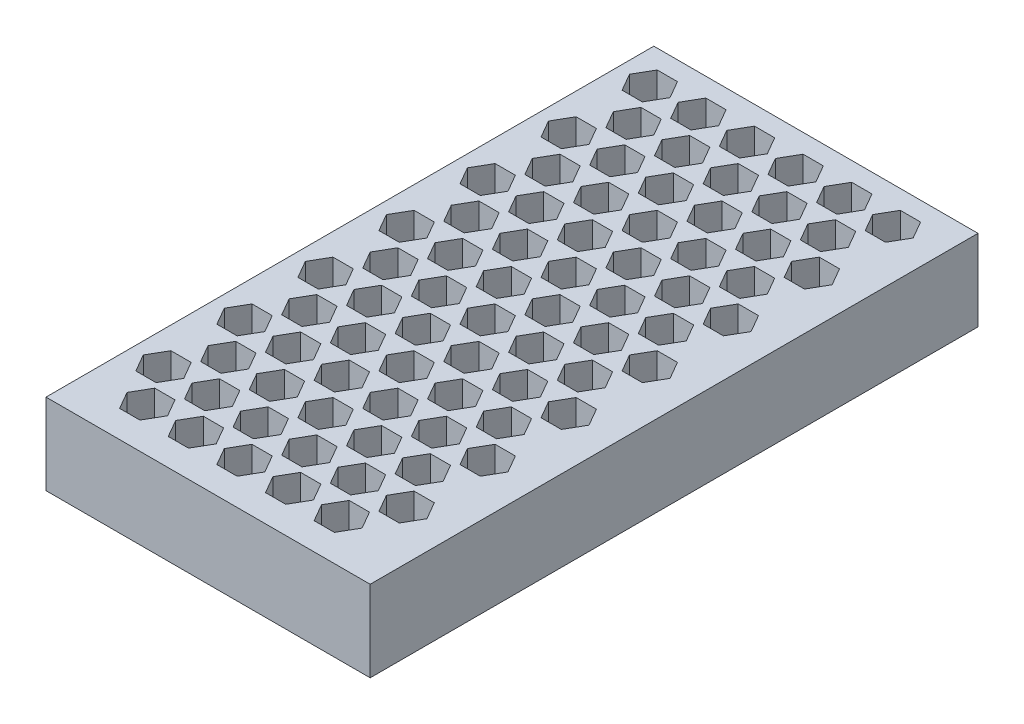
from build123d import *

# Parameters (mm, degrees)
SKETCH1_W           = 160
SKETCH1_H           = 300
BOSS_EXTRUDE1_DEPTH = 40
CUT_EXTRUDE1_DEPTH  = 40
SHELL1_OUTLINE_W    = 156
SHELL1_OUTLINE_H    = 296
SHELL1_DEPTH        = 38


# Read off the part's stored shape, not the designer's step: Shell1
with BuildPart() as part:
    # Sketch1 → Boss-Extrude1 (new body)
    with BuildSketch(Plane(origin=(0, 0, 0), x_dir=(1, 0, 0), z_dir=(0, 1, 0))):
        Rectangle(SKETCH1_W, SKETCH1_H)
    extrude(amount=BOSS_EXTRUDE1_DEPTH)

    # Sketch2 → Cut-Extrude1 (cut)
    with BuildSketch(Plane(origin=(0, 40, 0), x_dir=(1, 0, 0), z_dir=(0, 1, 0))):
        Polygon((-30, 132), (-35, 140.660254038), (-45, 140.660254038), (-50, 132), (-45, 123.339745962), (-35, 123.339745962), align=None)
        Polygon((-54, 132), (-59, 140.660254038), (-69, 140.660254038), (-74, 132), (-69, 123.339745962), (-59, 123.339745962), align=None)
        Polygon((-6, 132), (-11, 140.660254038), (-21, 140.660254038), (-26, 132), (-21, 123.339745962), (-11, 123.339745962), align=None)
        Polygon((18, 132), (13, 140.660254038), (3, 140.660254038), (-2, 132), (3, 123.339745962), (13, 123.339745962), align=None)
        Polygon((42, 132), (37, 140.660254038), (27, 140.660254038), (22, 132), (27, 123.339745962), (37, 123.339745962), align=None)
        Polygon((66, 132), (61, 140.660254038), (51, 140.660254038), (46, 132), (51, 123.339745962), (61, 123.339745962), align=None)
        Polygon((-33, 103.339745962), (-23, 103.339745962), (-18, 112), (-23, 120.660254038), (-33, 120.660254038), (-38, 112), align=None)
        Polygon((-57, 103.339745962), (-47, 103.339745962), (-42, 112), (-47, 120.660254038), (-57, 120.660254038), (-62, 112), align=None)
        Polygon((-9, 103.339745962), (1, 103.339745962), (6, 112), (1, 120.660254038), (-9, 120.660254038), (-14, 112), align=None)
        Polygon((15, 103.339745962), (25, 103.339745962), (30, 112), (25, 120.660254038), (15, 120.660254038), (10, 112), align=None)
        Polygon((39, 103.339745962), (49, 103.339745962), (54, 112), (49, 120.660254038), (39, 120.660254038), (34, 112), align=None)
        Polygon((-30, 92), (-35, 100.660254038), (-45, 100.660254038), (-50, 92), (-45, 83.339745962), (-35, 83.339745962), align=None)
        Polygon((-54, 92), (-59, 100.660254038), (-69, 100.660254038), (-74, 92), (-69, 83.339745962), (-59, 83.339745962), align=None)
        Polygon((-6, 92), (-11, 100.660254038), (-21, 100.660254038), (-26, 92), (-21, 83.339745962), (-11, 83.339745962), align=None)
        Polygon((18, 92), (13, 100.660254038), (3, 100.660254038), (-2, 92), (3, 83.339745962), (13, 83.339745962), align=None)
        Polygon((42, 92), (37, 100.660254038), (27, 100.660254038), (22, 92), (27, 83.339745962), (37, 83.339745962), align=None)
        Polygon((66, 92), (61, 100.660254038), (51, 100.660254038), (46, 92), (51, 83.339745962), (61, 83.339745962), align=None)
        Polygon((39, 63.339745962), (49, 63.339745962), (54, 72), (49, 80.660254038), (39, 80.660254038), (34, 72), align=None)
        Polygon((15, 63.339745962), (25, 63.339745962), (30, 72), (25, 80.660254038), (15, 80.660254038), (10, 72), align=None)
        Polygon((-9, 63.339745962), (1, 63.339745962), (6, 72), (1, 80.660254038), (-9, 80.660254038), (-14, 72), align=None)
        Polygon((-33, 63.339745962), (-23, 63.339745962), (-18, 72), (-23, 80.660254038), (-33, 80.660254038), (-38, 72), align=None)
        Polygon((-57, 63.339745962), (-47, 63.339745962), (-42, 72), (-47, 80.660254038), (-57, 80.660254038), (-62, 72), align=None)
        Polygon((-30, 52), (-35, 60.660254038), (-45, 60.660254038), (-50, 52), (-45, 43.339745962), (-35, 43.339745962), align=None)
        Polygon((-54, 52), (-59, 60.660254038), (-69, 60.660254038), (-74, 52), (-69, 43.339745962), (-59, 43.339745962), align=None)
        Polygon((-6, 52), (-11, 60.660254038), (-21, 60.660254038), (-26, 52), (-21, 43.339745962), (-11, 43.339745962), align=None)
        Polygon((18, 52), (13, 60.660254038), (3, 60.660254038), (-2, 52), (3, 43.339745962), (13, 43.339745962), align=None)
        Polygon((42, 52), (37, 60.660254038), (27, 60.660254038), (22, 52), (27, 43.339745962), (37, 43.339745962), align=None)
        Polygon((66, 52), (61, 60.660254038), (51, 60.660254038), (46, 52), (51, 43.339745962), (61, 43.339745962), align=None)
        Polygon((39, 23.339745962), (49, 23.339745962), (54, 32), (49, 40.660254038), (39, 40.660254038), (34, 32), align=None)
        Polygon((15, 23.339745962), (25, 23.339745962), (30, 32), (25, 40.660254038), (15, 40.660254038), (10, 32), align=None)
        Polygon((-9, 23.339745962), (1, 23.339745962), (6, 32), (1, 40.660254038), (-9, 40.660254038), (-14, 32), align=None)
        Polygon((-33, 23.339745962), (-23, 23.339745962), (-18, 32), (-23, 40.660254038), (-33, 40.660254038), (-38, 32), align=None)
        Polygon((-57, 23.339745962), (-47, 23.339745962), (-42, 32), (-47, 40.660254038), (-57, 40.660254038), (-62, 32), align=None)
        Polygon((-30, 12), (-35, 20.660254038), (-45, 20.660254038), (-50, 12), (-45, 3.339745962), (-35, 3.339745962), align=None)
        Polygon((-54, 12), (-59, 20.660254038), (-69, 20.660254038), (-74, 12), (-69, 3.339745962), (-59, 3.339745962), align=None)
        Polygon((-6, 12), (-11, 20.660254038), (-21, 20.660254038), (-26, 12), (-21, 3.339745962), (-11, 3.339745962), align=None)
        Polygon((18, 12), (13, 20.660254038), (3, 20.660254038), (-2, 12), (3, 3.339745962), (13, 3.339745962), align=None)
        Polygon((42, 12), (37, 20.660254038), (27, 20.660254038), (22, 12), (27, 3.339745962), (37, 3.339745962), align=None)
        Polygon((66, 12), (61, 20.660254038), (51, 20.660254038), (46, 12), (51, 3.339745962), (61, 3.339745962), align=None)
        Polygon((39, -16.660254038), (49, -16.660254038), (54, -8), (49, 0.660254038), (39, 0.660254038), (34, -8), align=None)
        Polygon((15, -16.660254038), (25, -16.660254038), (30, -8), (25, 0.660254038), (15, 0.660254038), (10, -8), align=None)
        Polygon((-9, -16.660254038), (1, -16.660254038), (6, -8), (1, 0.660254038), (-9, 0.660254038), (-14, -8), align=None)
        Polygon((-33, -16.660254038), (-23, -16.660254038), (-18, -8), (-23, 0.660254038), (-33, 0.660254038), (-38, -8), align=None)
        Polygon((-57, -16.660254038), (-47, -16.660254038), (-42, -8), (-47, 0.660254038), (-57, 0.660254038), (-62, -8), align=None)
        Polygon((-30, -28), (-35, -19.339745962), (-45, -19.339745962), (-50, -28), (-45, -36.660254038), (-35, -36.660254038), align=None)
        Polygon((-54, -28), (-59, -19.339745962), (-69, -19.339745962), (-74, -28), (-69, -36.660254038), (-59, -36.660254038), align=None)
        Polygon((-6, -28), (-11, -19.339745962), (-21, -19.339745962), (-26, -28), (-21, -36.660254038), (-11, -36.660254038), align=None)
        Polygon((18, -28), (13, -19.339745962), (3, -19.339745962), (-2, -28), (3, -36.660254038), (13, -36.660254038), align=None)
        Polygon((42, -28), (37, -19.339745962), (27, -19.339745962), (22, -28), (27, -36.660254038), (37, -36.660254038), align=None)
        Polygon((66, -28), (61, -19.339745962), (51, -19.339745962), (46, -28), (51, -36.660254038), (61, -36.660254038), align=None)
        Polygon((39, -56.660254038), (49, -56.660254038), (54, -48), (49, -39.339745962), (39, -39.339745962), (34, -48), align=None)
        Polygon((15, -56.660254038), (25, -56.660254038), (30, -48), (25, -39.339745962), (15, -39.339745962), (10, -48), align=None)
        Polygon((-9, -56.660254038), (1, -56.660254038), (6, -48), (1, -39.339745962), (-9, -39.339745962), (-14, -48), align=None)
        Polygon((-33, -56.660254038), (-23, -56.660254038), (-18, -48), (-23, -39.339745962), (-33, -39.339745962), (-38, -48), align=None)
        Polygon((-57, -56.660254038), (-47, -56.660254038), (-42, -48), (-47, -39.339745962), (-57, -39.339745962), (-62, -48), align=None)
        Polygon((-30, -68), (-35, -59.339745962), (-45, -59.339745962), (-50, -68), (-45, -76.660254038), (-35, -76.660254038), align=None)
        Polygon((-54, -68), (-59, -59.339745962), (-69, -59.339745962), (-74, -68), (-69, -76.660254038), (-59, -76.660254038), align=None)
        Polygon((-6, -68), (-11, -59.339745962), (-21, -59.339745962), (-26, -68), (-21, -76.660254038), (-11, -76.660254038), align=None)
        Polygon((18, -68), (13, -59.339745962), (3, -59.339745962), (-2, -68), (3, -76.660254038), (13, -76.660254038), align=None)
        Polygon((42, -68), (37, -59.339745962), (27, -59.339745962), (22, -68), (27, -76.660254038), (37, -76.660254038), align=None)
        Polygon((66, -68), (61, -59.339745962), (51, -59.339745962), (46, -68), (51, -76.660254038), (61, -76.660254038), align=None)
        Polygon((39, -96.660254038), (49, -96.660254038), (54, -88), (49, -79.339745962), (39, -79.339745962), (34, -88), align=None)
        Polygon((15, -96.660254038), (25, -96.660254038), (30, -88), (25, -79.339745962), (15, -79.339745962), (10, -88), align=None)
        Polygon((-9, -96.660254038), (1, -96.660254038), (6, -88), (1, -79.339745962), (-9, -79.339745962), (-14, -88), align=None)
        Polygon((-33, -96.660254038), (-23, -96.660254038), (-18, -88), (-23, -79.339745962), (-33, -79.339745962), (-38, -88), align=None)
        Polygon((-57, -96.660254038), (-47, -96.660254038), (-42, -88), (-47, -79.339745962), (-57, -79.339745962), (-62, -88), align=None)
        Polygon((-30, -108), (-35, -99.339745962), (-45, -99.339745962), (-50, -108), (-45, -116.660254038), (-35, -116.660254038), align=None)
        Polygon((-54, -108), (-59, -99.339745962), (-69, -99.339745962), (-74, -108), (-69, -116.660254038), (-59, -116.660254038), align=None)
        Polygon((-6, -108), (-11, -99.339745962), (-21, -99.339745962), (-26, -108), (-21, -116.660254038), (-11, -116.660254038), align=None)
        Polygon((18, -108), (13, -99.339745962), (3, -99.339745962), (-2, -108), (3, -116.660254038), (13, -116.660254038), align=None)
        Polygon((42, -108), (37, -99.339745962), (27, -99.339745962), (22, -108), (27, -116.660254038), (37, -116.660254038), align=None)
        Polygon((66, -108), (61, -99.339745962), (51, -99.339745962), (46, -108), (51, -116.660254038), (61, -116.660254038), align=None)
        Polygon((39, -136.660254038), (49, -136.660254038), (54, -128), (49, -119.339745962), (39, -119.339745962), (34, -128), align=None)
        Polygon((15, -136.660254038), (25, -136.660254038), (30, -128), (25, -119.339745962), (15, -119.339745962), (10, -128), align=None)
        Polygon((-9, -136.660254038), (1, -136.660254038), (6, -128), (1, -119.339745962), (-9, -119.339745962), (-14, -128), align=None)
        Polygon((-33, -136.660254038), (-23, -136.660254038), (-18, -128), (-23, -119.339745962), (-33, -119.339745962), (-38, -128), align=None)
        Polygon((-57, -136.660254038), (-47, -136.660254038), (-42, -128), (-47, -119.339745962), (-57, -119.339745962), (-62, -128), align=None)
    extrude(amount=-CUT_EXTRUDE1_DEPTH, mode=Mode.SUBTRACT)

    # Shell1 outline → Shell1 (cut)
    # profile 1 of 118: a face of its own
    with BuildSketch(Plane(origin=(0, 0, 0), x_dir=(1, 0, 0), z_dir=(0, 1, 0))):
        Rectangle(SHELL1_OUTLINE_W, SHELL1_OUTLINE_H)
        Polygon((-58.917096231, -38.660254038), (-70.154700538, -38.660254038), (-76.309401077, -28), (-70.154700538, -17.339745962), (-58.917096231, -17.339745962), (-64.309401077, -8), (-58.917096231, 1.339745962), (-70.154700538, 1.339745962), (-76.309401077, 12), (-70.154700538, 22.660254038), (-58.917096231, 22.660254038), (-64.309401077, 32), (-58.917096231, 41.339745962), (-70.154700538, 41.339745962), (-76.309401077, 52), (-70.154700538, 62.660254038), (-58.917096231, 62.660254038), (-64.309401077, 72), (-58.917096231, 81.339745962), (-70.154700538, 81.339745962), (-76.309401077, 92), (-70.154700538, 102.660254038), (-58.917096231, 102.660254038), (-64.309401077, 112), (-58.917096231, 121.339745962), (-70.154700538, 121.339745962), (-76.309401077, 132), (-70.154700538, 142.660254038), (-57.845299462, 142.660254038), (-52, 132.535898385), (-46.154700538, 142.660254038), (-33.845299462, 142.660254038), (-28, 132.535898385), (-22.154700538, 142.660254038), (-9.845299462, 142.660254038), (-4, 132.535898385), (1.845299462, 142.660254038), (14.154700538, 142.660254038), (20, 132.535898385), (25.845299462, 142.660254038), (38.154700538, 142.660254038), (44, 132.535898385), (49.845299462, 142.660254038), (62.154700538, 142.660254038), (68.309401077, 132), (62.154700538, 121.339745962), (50.917096231, 121.339745962), (56.309401077, 112), (50.917096231, 102.660254038), (62.154700538, 102.660254038), (68.309401077, 92), (62.154700538, 81.339745962), (50.917096231, 81.339745962), (56.309401077, 72), (50.917096231, 62.660254038), (62.154700538, 62.660254038), (68.309401077, 52), (62.154700538, 41.339745962), (50.917096231, 41.339745962), (56.309401077, 32), (50.917096231, 22.660254038), (62.154700538, 22.660254038), (68.309401077, 12), (62.154700538, 1.339745962), (50.917096231, 1.339745962), (56.309401077, -8), (50.917096231, -17.339745962), (62.154700538, -17.339745962), (68.309401077, -28), (62.154700538, -38.660254038), (50.917096231, -38.660254038), (56.309401077, -48), (50.917096231, -57.339745962), (62.154700538, -57.339745962), (68.309401077, -68), (62.154700538, -78.660254038), (50.917096231, -78.660254038), (56.309401077, -88), (50.917096231, -97.339745962), (62.154700538, -97.339745962), (68.309401077, -108), (62.154700538, -118.660254038), (50.917096231, -118.660254038), (56.309401077, -128), (50.154700538, -138.660254038), (37.845299462, -138.660254038), (32, -128.535898385), (26.154700538, -138.660254038), (13.845299462, -138.660254038), (8, -128.535898385), (2.154700538, -138.660254038), (-10.154700538, -138.660254038), (-16, -128.535898385), (-21.845299462, -138.660254038), (-34.154700538, -138.660254038), (-40, -128.535898385), (-45.845299462, -138.660254038), (-58.154700538, -138.660254038), (-64.309401077, -128), (-58.917096231, -118.660254038), (-70.154700538, -118.660254038), (-76.309401077, -108), (-70.154700538, -97.339745962), (-58.917096231, -97.339745962), (-64.309401077, -88), (-58.917096231, -78.660254038), (-70.154700538, -78.660254038), (-76.309401077, -68), (-70.154700538, -57.339745962), (-58.917096231, -57.339745962), (-64.309401077, -48), align=None, mode=Mode.SUBTRACT)
    # profile 2 of 118: a face of its own
    with BuildSketch(Plane(origin=(0, 0, 0), x_dir=(1, 0, 0), z_dir=(0, 1, 0))):
        Polygon((-57.082903769, 122.660254038), (-46.917096231, 122.660254038), (-52, 131.464101615), align=None)
    # profile 3 of 118: a face of its own
    with BuildSketch(Plane(origin=(0, 0, 0), x_dir=(1, 0, 0), z_dir=(0, 1, 0))):
        Polygon((38.917096231, 122.660254038), (49.082903769, 122.660254038), (44, 131.464101615), align=None)
    # profile 4 of 118: a face of its own
    with BuildSketch(Plane(origin=(0, 0, 0), x_dir=(1, 0, 0), z_dir=(0, 1, 0))):
        Polygon((14.917096231, 122.660254038), (25.082903769, 122.660254038), (20, 131.464101615), align=None)
    # profile 5 of 118: a face of its own
    with BuildSketch(Plane(origin=(0, 0, 0), x_dir=(1, 0, 0), z_dir=(0, 1, 0))):
        Polygon((-33.082903769, 122.660254038), (-22.917096231, 122.660254038), (-28, 131.464101615), align=None)
    # profile 6 of 118: a face of its own
    with BuildSketch(Plane(origin=(0, 0, 0), x_dir=(1, 0, 0), z_dir=(0, 1, 0))):
        Polygon((-4, 131.464101615), (-9.082903769, 122.660254038), (1.082903769, 122.660254038), align=None)
    # profile 7 of 118: a face of its own
    with BuildSketch(Plane(origin=(0, 0, 0), x_dir=(1, 0, 0), z_dir=(0, 1, 0))):
        Polygon((-34.917096231, 121.339745962), (-45.082903769, 121.339745962), (-40, 112.535898385), align=None)
    # profile 8 of 118: a face of its own
    with BuildSketch(Plane(origin=(0, 0, 0), x_dir=(1, 0, 0), z_dir=(0, 1, 0))):
        Polygon((37.082903769, 121.339745962), (26.917096231, 121.339745962), (32, 112.535898385), align=None)
    # profile 9 of 118: a face of its own
    with BuildSketch(Plane(origin=(0, 0, 0), x_dir=(1, 0, 0), z_dir=(0, 1, 0))):
        Polygon((-10.917096231, 121.339745962), (-21.082903769, 121.339745962), (-16, 112.535898385), align=None)
    # profile 10 of 118: a face of its own
    with BuildSketch(Plane(origin=(0, 0, 0), x_dir=(1, 0, 0), z_dir=(0, 1, 0))):
        Polygon((13.082903769, 121.339745962), (2.917096231, 121.339745962), (8, 112.535898385), align=None)
    # profile 11 of 118: a face of its own
    with BuildSketch(Plane(origin=(0, 0, 0), x_dir=(1, 0, 0), z_dir=(0, 1, 0))):
        Polygon((26.917096231, 102.660254038), (37.082903769, 102.660254038), (32, 111.464101615), align=None)
    # profile 12 of 118: a face of its own
    with BuildSketch(Plane(origin=(0, 0, 0), x_dir=(1, 0, 0), z_dir=(0, 1, 0))):
        Polygon((-45.082903769, 102.660254038), (-34.917096231, 102.660254038), (-40, 111.464101615), align=None)
    # profile 13 of 118: a face of its own
    with BuildSketch(Plane(origin=(0, 0, 0), x_dir=(1, 0, 0), z_dir=(0, 1, 0))):
        Polygon((2.917096231, 102.660254038), (13.082903769, 102.660254038), (8, 111.464101615), align=None)
    # profile 14 of 118: a face of its own
    with BuildSketch(Plane(origin=(0, 0, 0), x_dir=(1, 0, 0), z_dir=(0, 1, 0))):
        Polygon((-16, 111.464101615), (-21.082903769, 102.660254038), (-10.917096231, 102.660254038), align=None)
    # profile 15 of 118: a face of its own
    with BuildSketch(Plane(origin=(0, 0, 0), x_dir=(1, 0, 0), z_dir=(0, 1, 0))):
        Polygon((-46.917096231, 101.339745962), (-57.082903769, 101.339745962), (-52, 92.535898385), align=None)
    # profile 16 of 118: a face of its own
    with BuildSketch(Plane(origin=(0, 0, 0), x_dir=(1, 0, 0), z_dir=(0, 1, 0))):
        Polygon((25.082903769, 101.339745962), (14.917096231, 101.339745962), (20, 92.535898385), align=None)
    # profile 17 of 118: a face of its own
    with BuildSketch(Plane(origin=(0, 0, 0), x_dir=(1, 0, 0), z_dir=(0, 1, 0))):
        Polygon((49.082903769, 101.339745962), (38.917096231, 101.339745962), (44, 92.535898385), align=None)
    # profile 18 of 118: a face of its own
    with BuildSketch(Plane(origin=(0, 0, 0), x_dir=(1, 0, 0), z_dir=(0, 1, 0))):
        Polygon((1.082903769, 101.339745962), (-9.082903769, 101.339745962), (-4, 92.535898385), align=None)
    # profile 19 of 118: a face of its own
    with BuildSketch(Plane(origin=(0, 0, 0), x_dir=(1, 0, 0), z_dir=(0, 1, 0))):
        Polygon((-33.082903769, 101.339745962), (-28, 92.535898385), (-22.917096231, 101.339745962), align=None)
    # profile 20 of 118: a face of its own
    with BuildSketch(Plane(origin=(0, 0, 0), x_dir=(1, 0, 0), z_dir=(0, 1, 0))):
        Polygon((-45.082903769, -57.339745962), (-34.917096231, -57.339745962), (-40, -48.535898385), align=None)
    # profile 21 of 118: a face of its own
    with BuildSketch(Plane(origin=(0, 0, 0), x_dir=(1, 0, 0), z_dir=(0, 1, 0))):
        Polygon((-21.082903769, -57.339745962), (-10.917096231, -57.339745962), (-16, -48.535898385), align=None)
    # profile 22 of 118: a face of its own
    with BuildSketch(Plane(origin=(0, 0, 0), x_dir=(1, 0, 0), z_dir=(0, 1, 0))):
        Polygon((26.917096231, -57.339745962), (37.082903769, -57.339745962), (32, -48.535898385), align=None)
    # profile 23 of 118: a face of its own
    with BuildSketch(Plane(origin=(0, 0, 0), x_dir=(1, 0, 0), z_dir=(0, 1, 0))):
        Polygon((8, -48.535898385), (2.917096231, -57.339745962), (13.082903769, -57.339745962), align=None)
    # profile 24 of 118: a face of its own
    with BuildSketch(Plane(origin=(0, 0, 0), x_dir=(1, 0, 0), z_dir=(0, 1, 0))):
        Polygon((-46.917096231, -58.660254038), (-57.082903769, -58.660254038), (-52, -67.464101615), align=None)
    # profile 25 of 118: a face of its own
    with BuildSketch(Plane(origin=(0, 0, 0), x_dir=(1, 0, 0), z_dir=(0, 1, 0))):
        Polygon((-22.917096231, -58.660254038), (-33.082903769, -58.660254038), (-28, -67.464101615), align=None)
    # profile 26 of 118: a face of its own
    with BuildSketch(Plane(origin=(0, 0, 0), x_dir=(1, 0, 0), z_dir=(0, 1, 0))):
        Polygon((49.082903769, -58.660254038), (38.917096231, -58.660254038), (44, -67.464101615), align=None)
    # profile 27 of 118: a face of its own
    with BuildSketch(Plane(origin=(0, 0, 0), x_dir=(1, 0, 0), z_dir=(0, 1, 0))):
        Polygon((25.082903769, -58.660254038), (14.917096231, -58.660254038), (20, -67.464101615), align=None)
    # profile 28 of 118: a face of its own
    with BuildSketch(Plane(origin=(0, 0, 0), x_dir=(1, 0, 0), z_dir=(0, 1, 0))):
        Polygon((-9.082903769, -58.660254038), (-4, -67.464101615), (1.082903769, -58.660254038), align=None)
    # profile 29 of 118: a face of its own
    with BuildSketch(Plane(origin=(0, 0, 0), x_dir=(1, 0, 0), z_dir=(0, 1, 0))):
        Polygon((-10.917096231, -118.660254038), (-21.082903769, -118.660254038), (-16, -127.464101615), align=None)
    # profile 30 of 118: a face of its own
    with BuildSketch(Plane(origin=(0, 0, 0), x_dir=(1, 0, 0), z_dir=(0, 1, 0))):
        Polygon((-34.917096231, -118.660254038), (-45.082903769, -118.660254038), (-40, -127.464101615), align=None)
    # profile 31 of 118: a face of its own
    with BuildSketch(Plane(origin=(0, 0, 0), x_dir=(1, 0, 0), z_dir=(0, 1, 0))):
        Polygon((13.082903769, -118.660254038), (2.917096231, -118.660254038), (8, -127.464101615), align=None)
    # profile 32 of 118: a face of its own
    with BuildSketch(Plane(origin=(0, 0, 0), x_dir=(1, 0, 0), z_dir=(0, 1, 0))):
        Polygon((32, -127.464101615), (37.082903769, -118.660254038), (26.917096231, -118.660254038), align=None)
    # profile 33 of 118: a face of its own
    with BuildSketch(Plane(origin=(0, 0, 0), x_dir=(1, 0, 0), z_dir=(0, 1, 0))):
        Polygon((38.917096231, -77.339745962), (49.082903769, -77.339745962), (44, -68.535898385), align=None)
    # profile 34 of 118: a face of its own
    with BuildSketch(Plane(origin=(0, 0, 0), x_dir=(1, 0, 0), z_dir=(0, 1, 0))):
        Polygon((14.917096231, -77.339745962), (25.082903769, -77.339745962), (20, -68.535898385), align=None)
    # profile 35 of 118: a face of its own
    with BuildSketch(Plane(origin=(0, 0, 0), x_dir=(1, 0, 0), z_dir=(0, 1, 0))):
        Polygon((-9.082903769, -77.339745962), (1.082903769, -77.339745962), (-4, -68.535898385), align=None)
    # profile 36 of 118: a face of its own
    with BuildSketch(Plane(origin=(0, 0, 0), x_dir=(1, 0, 0), z_dir=(0, 1, 0))):
        Polygon((-57.082903769, -77.339745962), (-46.917096231, -77.339745962), (-52, -68.535898385), align=None)
    # profile 37 of 118: a face of its own
    with BuildSketch(Plane(origin=(0, 0, 0), x_dir=(1, 0, 0), z_dir=(0, 1, 0))):
        Polygon((-28, -68.535898385), (-33.082903769, -77.339745962), (-22.917096231, -77.339745962), align=None)
    # profile 38 of 118: a face of its own
    with BuildSketch(Plane(origin=(0, 0, 0), x_dir=(1, 0, 0), z_dir=(0, 1, 0))):
        Polygon((13.082903769, -78.660254038), (2.917096231, -78.660254038), (8, -87.464101615), align=None)
    # profile 39 of 118: a face of its own
    with BuildSketch(Plane(origin=(0, 0, 0), x_dir=(1, 0, 0), z_dir=(0, 1, 0))):
        Polygon((37.082903769, -78.660254038), (26.917096231, -78.660254038), (32, -87.464101615), align=None)
    # profile 40 of 118: a face of its own
    with BuildSketch(Plane(origin=(0, 0, 0), x_dir=(1, 0, 0), z_dir=(0, 1, 0))):
        Polygon((-34.917096231, -78.660254038), (-45.082903769, -78.660254038), (-40, -87.464101615), align=None)
    # profile 41 of 118: a face of its own
    with BuildSketch(Plane(origin=(0, 0, 0), x_dir=(1, 0, 0), z_dir=(0, 1, 0))):
        Polygon((-10.917096231, -78.660254038), (-21.082903769, -78.660254038), (-16, -87.464101615), align=None)
    # profile 42 of 118: a face of its own
    with BuildSketch(Plane(origin=(0, 0, 0), x_dir=(1, 0, 0), z_dir=(0, 1, 0))):
        Polygon((2.917096231, -97.339745962), (13.082903769, -97.339745962), (8, -88.535898385), align=None)
    # profile 43 of 118: a face of its own
    with BuildSketch(Plane(origin=(0, 0, 0), x_dir=(1, 0, 0), z_dir=(0, 1, 0))):
        Polygon((-45.082903769, -97.339745962), (-34.917096231, -97.339745962), (-40, -88.535898385), align=None)
    # profile 44 of 118: a face of its own
    with BuildSketch(Plane(origin=(0, 0, 0), x_dir=(1, 0, 0), z_dir=(0, 1, 0))):
        Polygon((26.917096231, -97.339745962), (37.082903769, -97.339745962), (32, -88.535898385), align=None)
    # profile 45 of 118: a face of its own
    with BuildSketch(Plane(origin=(0, 0, 0), x_dir=(1, 0, 0), z_dir=(0, 1, 0))):
        Polygon((-21.082903769, -97.339745962), (-10.917096231, -97.339745962), (-16, -88.535898385), align=None)
    # profile 46 of 118: a face of its own
    with BuildSketch(Plane(origin=(0, 0, 0), x_dir=(1, 0, 0), z_dir=(0, 1, 0))):
        Polygon((-22.917096231, -98.660254038), (-33.082903769, -98.660254038), (-28, -107.464101615), align=None)
    # profile 47 of 118: a face of its own
    with BuildSketch(Plane(origin=(0, 0, 0), x_dir=(1, 0, 0), z_dir=(0, 1, 0))):
        Polygon((-46.917096231, -98.660254038), (-57.082903769, -98.660254038), (-52, -107.464101615), align=None)
    # profile 48 of 118: a face of its own
    with BuildSketch(Plane(origin=(0, 0, 0), x_dir=(1, 0, 0), z_dir=(0, 1, 0))):
        Polygon((25.082903769, -98.660254038), (14.917096231, -98.660254038), (20, -107.464101615), align=None)
    # profile 49 of 118: a face of its own
    with BuildSketch(Plane(origin=(0, 0, 0), x_dir=(1, 0, 0), z_dir=(0, 1, 0))):
        Polygon((49.082903769, -98.660254038), (38.917096231, -98.660254038), (44, -107.464101615), align=None)
    # profile 50 of 118: a face of its own
    with BuildSketch(Plane(origin=(0, 0, 0), x_dir=(1, 0, 0), z_dir=(0, 1, 0))):
        Polygon((1.082903769, -98.660254038), (-9.082903769, -98.660254038), (-4, -107.464101615), align=None)
    # profile 51 of 118: a face of its own
    with BuildSketch(Plane(origin=(0, 0, 0), x_dir=(1, 0, 0), z_dir=(0, 1, 0))):
        Polygon((-57.082903769, -117.339745962), (-46.917096231, -117.339745962), (-52, -108.535898385), align=None)
    # profile 52 of 118: a face of its own
    with BuildSketch(Plane(origin=(0, 0, 0), x_dir=(1, 0, 0), z_dir=(0, 1, 0))):
        Polygon((-33.082903769, -117.339745962), (-22.917096231, -117.339745962), (-28, -108.535898385), align=None)
    # profile 53 of 118: a face of its own
    with BuildSketch(Plane(origin=(0, 0, 0), x_dir=(1, 0, 0), z_dir=(0, 1, 0))):
        Polygon((14.917096231, -117.339745962), (25.082903769, -117.339745962), (20, -108.535898385), align=None)
    # profile 54 of 118: a face of its own
    with BuildSketch(Plane(origin=(0, 0, 0), x_dir=(1, 0, 0), z_dir=(0, 1, 0))):
        Polygon((38.917096231, -117.339745962), (49.082903769, -117.339745962), (44, -108.535898385), align=None)
    # profile 55 of 118: a face of its own
    with BuildSketch(Plane(origin=(0, 0, 0), x_dir=(1, 0, 0), z_dir=(0, 1, 0))):
        Polygon((-9.082903769, -117.339745962), (1.082903769, -117.339745962), (-4, -108.535898385), align=None)
    # profile 56 of 118: a face of its own
    with BuildSketch(Plane(origin=(0, 0, 0), x_dir=(1, 0, 0), z_dir=(0, 1, 0))):
        Polygon((38.917096231, 82.660254038), (49.082903769, 82.660254038), (44, 91.464101615), align=None)
    # profile 57 of 118: a face of its own
    with BuildSketch(Plane(origin=(0, 0, 0), x_dir=(1, 0, 0), z_dir=(0, 1, 0))):
        Polygon((-57.082903769, 82.660254038), (-46.917096231, 82.660254038), (-52, 91.464101615), align=None)
    # profile 58 of 118: a face of its own
    with BuildSketch(Plane(origin=(0, 0, 0), x_dir=(1, 0, 0), z_dir=(0, 1, 0))):
        Polygon((-33.082903769, 82.660254038), (-22.917096231, 82.660254038), (-28, 91.464101615), align=None)
    # profile 59 of 118: a face of its own
    with BuildSketch(Plane(origin=(0, 0, 0), x_dir=(1, 0, 0), z_dir=(0, 1, 0))):
        Polygon((-9.082903769, 82.660254038), (1.082903769, 82.660254038), (-4, 91.464101615), align=None)
    # profile 60 of 118: a face of its own
    with BuildSketch(Plane(origin=(0, 0, 0), x_dir=(1, 0, 0), z_dir=(0, 1, 0))):
        Polygon((20, 91.464101615), (14.917096231, 82.660254038), (25.082903769, 82.660254038), align=None)
    # profile 61 of 118: a face of its own
    with BuildSketch(Plane(origin=(0, 0, 0), x_dir=(1, 0, 0), z_dir=(0, 1, 0))):
        Polygon((-34.917096231, 81.339745962), (-45.082903769, 81.339745962), (-40, 72.535898385), align=None)
    # profile 62 of 118: a face of its own
    with BuildSketch(Plane(origin=(0, 0, 0), x_dir=(1, 0, 0), z_dir=(0, 1, 0))):
        Polygon((-10.917096231, 81.339745962), (-21.082903769, 81.339745962), (-16, 72.535898385), align=None)
    # profile 63 of 118: a face of its own
    with BuildSketch(Plane(origin=(0, 0, 0), x_dir=(1, 0, 0), z_dir=(0, 1, 0))):
        Polygon((13.082903769, 81.339745962), (2.917096231, 81.339745962), (8, 72.535898385), align=None)
    # profile 64 of 118: a face of its own
    with BuildSketch(Plane(origin=(0, 0, 0), x_dir=(1, 0, 0), z_dir=(0, 1, 0))):
        Polygon((37.082903769, 81.339745962), (26.917096231, 81.339745962), (32, 72.535898385), align=None)
    # profile 65 of 118: a face of its own
    with BuildSketch(Plane(origin=(0, 0, 0), x_dir=(1, 0, 0), z_dir=(0, 1, 0))):
        Polygon((-21.082903769, 62.660254038), (-10.917096231, 62.660254038), (-16, 71.464101615), align=None)
    # profile 66 of 118: a face of its own
    with BuildSketch(Plane(origin=(0, 0, 0), x_dir=(1, 0, 0), z_dir=(0, 1, 0))):
        Polygon((-45.082903769, 62.660254038), (-34.917096231, 62.660254038), (-40, 71.464101615), align=None)
    # profile 67 of 118: a face of its own
    with BuildSketch(Plane(origin=(0, 0, 0), x_dir=(1, 0, 0), z_dir=(0, 1, 0))):
        Polygon((26.917096231, 62.660254038), (37.082903769, 62.660254038), (32, 71.464101615), align=None)
    # profile 68 of 118: a face of its own
    with BuildSketch(Plane(origin=(0, 0, 0), x_dir=(1, 0, 0), z_dir=(0, 1, 0))):
        Polygon((8, 71.464101615), (2.917096231, 62.660254038), (13.082903769, 62.660254038), align=None)
    # profile 69 of 118: a face of its own
    with BuildSketch(Plane(origin=(0, 0, 0), x_dir=(1, 0, 0), z_dir=(0, 1, 0))):
        Polygon((-22.917096231, 61.339745962), (-33.082903769, 61.339745962), (-28, 52.535898385), align=None)
    # profile 70 of 118: a face of its own
    with BuildSketch(Plane(origin=(0, 0, 0), x_dir=(1, 0, 0), z_dir=(0, 1, 0))):
        Polygon((-46.917096231, 61.339745962), (-57.082903769, 61.339745962), (-52, 52.535898385), align=None)
    # profile 71 of 118: a face of its own
    with BuildSketch(Plane(origin=(0, 0, 0), x_dir=(1, 0, 0), z_dir=(0, 1, 0))):
        Polygon((49.082903769, 61.339745962), (38.917096231, 61.339745962), (44, 52.535898385), align=None)
    # profile 72 of 118: a face of its own
    with BuildSketch(Plane(origin=(0, 0, 0), x_dir=(1, 0, 0), z_dir=(0, 1, 0))):
        Polygon((25.082903769, 61.339745962), (14.917096231, 61.339745962), (20, 52.535898385), align=None)
    # profile 73 of 118: a face of its own
    with BuildSketch(Plane(origin=(0, 0, 0), x_dir=(1, 0, 0), z_dir=(0, 1, 0))):
        Polygon((-9.082903769, 61.339745962), (-4, 52.535898385), (1.082903769, 61.339745962), align=None)
    # profile 74 of 118: a face of its own
    with BuildSketch(Plane(origin=(0, 0, 0), x_dir=(1, 0, 0), z_dir=(0, 1, 0))):
        Polygon((-57.082903769, 42.660254038), (-46.917096231, 42.660254038), (-52, 51.464101615), align=None)
    # profile 75 of 118: a face of its own
    with BuildSketch(Plane(origin=(0, 0, 0), x_dir=(1, 0, 0), z_dir=(0, 1, 0))):
        Polygon((-33.082903769, 42.660254038), (-22.917096231, 42.660254038), (-28, 51.464101615), align=None)
    # profile 76 of 118: a face of its own
    with BuildSketch(Plane(origin=(0, 0, 0), x_dir=(1, 0, 0), z_dir=(0, 1, 0))):
        Polygon((38.917096231, 42.660254038), (49.082903769, 42.660254038), (44, 51.464101615), align=None)
    # profile 77 of 118: a face of its own
    with BuildSketch(Plane(origin=(0, 0, 0), x_dir=(1, 0, 0), z_dir=(0, 1, 0))):
        Polygon((14.917096231, 42.660254038), (25.082903769, 42.660254038), (20, 51.464101615), align=None)
    # profile 78 of 118: a face of its own
    with BuildSketch(Plane(origin=(0, 0, 0), x_dir=(1, 0, 0), z_dir=(0, 1, 0))):
        Polygon((1.082903769, 42.660254038), (-4, 51.464101615), (-9.082903769, 42.660254038), align=None)
    # profile 79 of 118: a face of its own
    with BuildSketch(Plane(origin=(0, 0, 0), x_dir=(1, 0, 0), z_dir=(0, 1, 0))):
        Polygon((-34.917096231, 41.339745962), (-45.082903769, 41.339745962), (-40, 32.535898385), align=None)
    # profile 80 of 118: a face of its own
    with BuildSketch(Plane(origin=(0, 0, 0), x_dir=(1, 0, 0), z_dir=(0, 1, 0))):
        Polygon((37.082903769, 41.339745962), (26.917096231, 41.339745962), (32, 32.535898385), align=None)
    # profile 81 of 118: a face of its own
    with BuildSketch(Plane(origin=(0, 0, 0), x_dir=(1, 0, 0), z_dir=(0, 1, 0))):
        Polygon((13.082903769, 41.339745962), (2.917096231, 41.339745962), (8, 32.535898385), align=None)
    # profile 82 of 118: a face of its own
    with BuildSketch(Plane(origin=(0, 0, 0), x_dir=(1, 0, 0), z_dir=(0, 1, 0))):
        Polygon((-21.082903769, 41.339745962), (-16, 32.535898385), (-10.917096231, 41.339745962), align=None)
    # profile 83 of 118: a face of its own
    with BuildSketch(Plane(origin=(0, 0, 0), x_dir=(1, 0, 0), z_dir=(0, 1, 0))):
        Polygon((26.917096231, 22.660254038), (37.082903769, 22.660254038), (32, 31.464101615), align=None)
    # profile 84 of 118: a face of its own
    with BuildSketch(Plane(origin=(0, 0, 0), x_dir=(1, 0, 0), z_dir=(0, 1, 0))):
        Polygon((-45.082903769, 22.660254038), (-34.917096231, 22.660254038), (-40, 31.464101615), align=None)
    # profile 85 of 118: a face of its own
    with BuildSketch(Plane(origin=(0, 0, 0), x_dir=(1, 0, 0), z_dir=(0, 1, 0))):
        Polygon((-21.082903769, 22.660254038), (-10.917096231, 22.660254038), (-16, 31.464101615), align=None)
    # profile 86 of 118: a face of its own
    with BuildSketch(Plane(origin=(0, 0, 0), x_dir=(1, 0, 0), z_dir=(0, 1, 0))):
        Polygon((8, 31.464101615), (2.917096231, 22.660254038), (13.082903769, 22.660254038), align=None)
    # profile 87 of 118: a face of its own
    with BuildSketch(Plane(origin=(0, 0, 0), x_dir=(1, 0, 0), z_dir=(0, 1, 0))):
        Polygon((49.082903769, 21.339745962), (38.917096231, 21.339745962), (44, 12.535898385), align=None)
    # profile 88 of 118: a face of its own
    with BuildSketch(Plane(origin=(0, 0, 0), x_dir=(1, 0, 0), z_dir=(0, 1, 0))):
        Polygon((-46.917096231, 21.339745962), (-57.082903769, 21.339745962), (-52, 12.535898385), align=None)
    # profile 89 of 118: a face of its own
    with BuildSketch(Plane(origin=(0, 0, 0), x_dir=(1, 0, 0), z_dir=(0, 1, 0))):
        Polygon((-22.917096231, 21.339745962), (-33.082903769, 21.339745962), (-28, 12.535898385), align=None)
    # profile 90 of 118: a face of its own
    with BuildSketch(Plane(origin=(0, 0, 0), x_dir=(1, 0, 0), z_dir=(0, 1, 0))):
        Polygon((1.082903769, 21.339745962), (-9.082903769, 21.339745962), (-4, 12.535898385), align=None)
    # profile 91 of 118: a face of its own
    with BuildSketch(Plane(origin=(0, 0, 0), x_dir=(1, 0, 0), z_dir=(0, 1, 0))):
        Polygon((25.082903769, 21.339745962), (14.917096231, 21.339745962), (20, 12.535898385), align=None)
    # profile 92 of 118: a face of its own
    with BuildSketch(Plane(origin=(0, 0, 0), x_dir=(1, 0, 0), z_dir=(0, 1, 0))):
        Polygon((38.917096231, 2.660254038), (49.082903769, 2.660254038), (44, 11.464101615), align=None)
    # profile 93 of 118: a face of its own
    with BuildSketch(Plane(origin=(0, 0, 0), x_dir=(1, 0, 0), z_dir=(0, 1, 0))):
        Polygon((-33.082903769, 2.660254038), (-22.917096231, 2.660254038), (-28, 11.464101615), align=None)
    # profile 94 of 118: a face of its own
    with BuildSketch(Plane(origin=(0, 0, 0), x_dir=(1, 0, 0), z_dir=(0, 1, 0))):
        Polygon((-57.082903769, 2.660254038), (-46.917096231, 2.660254038), (-52, 11.464101615), align=None)
    # profile 95 of 118: a face of its own
    with BuildSketch(Plane(origin=(0, 0, 0), x_dir=(1, 0, 0), z_dir=(0, 1, 0))):
        Polygon((14.917096231, 2.660254038), (25.082903769, 2.660254038), (20, 11.464101615), align=None)
    # profile 96 of 118: a face of its own
    with BuildSketch(Plane(origin=(0, 0, 0), x_dir=(1, 0, 0), z_dir=(0, 1, 0))):
        Polygon((-4, 11.464101615), (-9.082903769, 2.660254038), (1.082903769, 2.660254038), align=None)
    # profile 97 of 118: a face of its own
    with BuildSketch(Plane(origin=(0, 0, 0), x_dir=(1, 0, 0), z_dir=(0, 1, 0))):
        Polygon((37.082903769, 1.339745962), (26.917096231, 1.339745962), (32, -7.464101615), align=None)
    # profile 98 of 118: a face of its own
    with BuildSketch(Plane(origin=(0, 0, 0), x_dir=(1, 0, 0), z_dir=(0, 1, 0))):
        Polygon((-34.917096231, 1.339745962), (-45.082903769, 1.339745962), (-40, -7.464101615), align=None)
    # profile 99 of 118: a face of its own
    with BuildSketch(Plane(origin=(0, 0, 0), x_dir=(1, 0, 0), z_dir=(0, 1, 0))):
        Polygon((13.082903769, 1.339745962), (2.917096231, 1.339745962), (8, -7.464101615), align=None)
    # profile 100 of 118: a face of its own
    with BuildSketch(Plane(origin=(0, 0, 0), x_dir=(1, 0, 0), z_dir=(0, 1, 0))):
        Polygon((-21.082903769, 1.339745962), (-16, -7.464101615), (-10.917096231, 1.339745962), align=None)
    # profile 101 of 118: a face of its own
    with BuildSketch(Plane(origin=(0, 0, 0), x_dir=(1, 0, 0), z_dir=(0, 1, 0))):
        Polygon((26.917096231, -17.339745962), (37.082903769, -17.339745962), (32, -8.535898385), align=None)
    # profile 102 of 118: a face of its own
    with BuildSketch(Plane(origin=(0, 0, 0), x_dir=(1, 0, 0), z_dir=(0, 1, 0))):
        Polygon((-45.082903769, -17.339745962), (-34.917096231, -17.339745962), (-40, -8.535898385), align=None)
    # profile 103 of 118: a face of its own
    with BuildSketch(Plane(origin=(0, 0, 0), x_dir=(1, 0, 0), z_dir=(0, 1, 0))):
        Polygon((-21.082903769, -17.339745962), (-10.917096231, -17.339745962), (-16, -8.535898385), align=None)
    # profile 104 of 118: a face of its own
    with BuildSketch(Plane(origin=(0, 0, 0), x_dir=(1, 0, 0), z_dir=(0, 1, 0))):
        Polygon((8, -8.535898385), (2.917096231, -17.339745962), (13.082903769, -17.339745962), align=None)
    # profile 105 of 118: a face of its own
    with BuildSketch(Plane(origin=(0, 0, 0), x_dir=(1, 0, 0), z_dir=(0, 1, 0))):
        Polygon((49.082903769, -18.660254038), (38.917096231, -18.660254038), (44, -27.464101615), align=None)
    # profile 106 of 118: a face of its own
    with BuildSketch(Plane(origin=(0, 0, 0), x_dir=(1, 0, 0), z_dir=(0, 1, 0))):
        Polygon((-22.917096231, -18.660254038), (-33.082903769, -18.660254038), (-28, -27.464101615), align=None)
    # profile 107 of 118: a face of its own
    with BuildSketch(Plane(origin=(0, 0, 0), x_dir=(1, 0, 0), z_dir=(0, 1, 0))):
        Polygon((-46.917096231, -18.660254038), (-57.082903769, -18.660254038), (-52, -27.464101615), align=None)
    # profile 108 of 118: a face of its own
    with BuildSketch(Plane(origin=(0, 0, 0), x_dir=(1, 0, 0), z_dir=(0, 1, 0))):
        Polygon((1.082903769, -18.660254038), (-9.082903769, -18.660254038), (-4, -27.464101615), align=None)
    # profile 109 of 118: a face of its own
    with BuildSketch(Plane(origin=(0, 0, 0), x_dir=(1, 0, 0), z_dir=(0, 1, 0))):
        Polygon((25.082903769, -18.660254038), (14.917096231, -18.660254038), (20, -27.464101615), align=None)
    # profile 110 of 118: a face of its own
    with BuildSketch(Plane(origin=(0, 0, 0), x_dir=(1, 0, 0), z_dir=(0, 1, 0))):
        Polygon((-34.917096231, -38.660254038), (-45.082903769, -38.660254038), (-40, -47.464101615), align=None)
    # profile 111 of 118: a face of its own
    with BuildSketch(Plane(origin=(0, 0, 0), x_dir=(1, 0, 0), z_dir=(0, 1, 0))):
        Polygon((-10.917096231, -38.660254038), (-21.082903769, -38.660254038), (-16, -47.464101615), align=None)
    # profile 112 of 118: a face of its own
    with BuildSketch(Plane(origin=(0, 0, 0), x_dir=(1, 0, 0), z_dir=(0, 1, 0))):
        Polygon((13.082903769, -38.660254038), (2.917096231, -38.660254038), (8, -47.464101615), align=None)
    # profile 113 of 118: a face of its own
    with BuildSketch(Plane(origin=(0, 0, 0), x_dir=(1, 0, 0), z_dir=(0, 1, 0))):
        Polygon((32, -47.464101615), (37.082903769, -38.660254038), (26.917096231, -38.660254038), align=None)
    # profile 114 of 118: a face of its own
    with BuildSketch(Plane(origin=(0, 0, 0), x_dir=(1, 0, 0), z_dir=(0, 1, 0))):
        Polygon((-57.082903769, -37.339745962), (-46.917096231, -37.339745962), (-52, -28.535898385), align=None)
    # profile 115 of 118: a face of its own
    with BuildSketch(Plane(origin=(0, 0, 0), x_dir=(1, 0, 0), z_dir=(0, 1, 0))):
        Polygon((-33.082903769, -37.339745962), (-22.917096231, -37.339745962), (-28, -28.535898385), align=None)
    # profile 116 of 118: a face of its own
    with BuildSketch(Plane(origin=(0, 0, 0), x_dir=(1, 0, 0), z_dir=(0, 1, 0))):
        Polygon((-9.082903769, -37.339745962), (1.082903769, -37.339745962), (-4, -28.535898385), align=None)
    # profile 117 of 118: a face of its own
    with BuildSketch(Plane(origin=(0, 0, 0), x_dir=(1, 0, 0), z_dir=(0, 1, 0))):
        Polygon((14.917096231, -37.339745962), (25.082903769, -37.339745962), (20, -28.535898385), align=None)
    # profile 118 of 118: a face of its own
    with BuildSketch(Plane(origin=(0, 0, 0), x_dir=(1, 0, 0), z_dir=(0, 1, 0))):
        Polygon((44, -28.535898385), (38.917096231, -37.339745962), (49.082903769, -37.339745962), align=None)
    extrude(amount=SHELL1_DEPTH, mode=Mode.SUBTRACT)


solid = part.part
